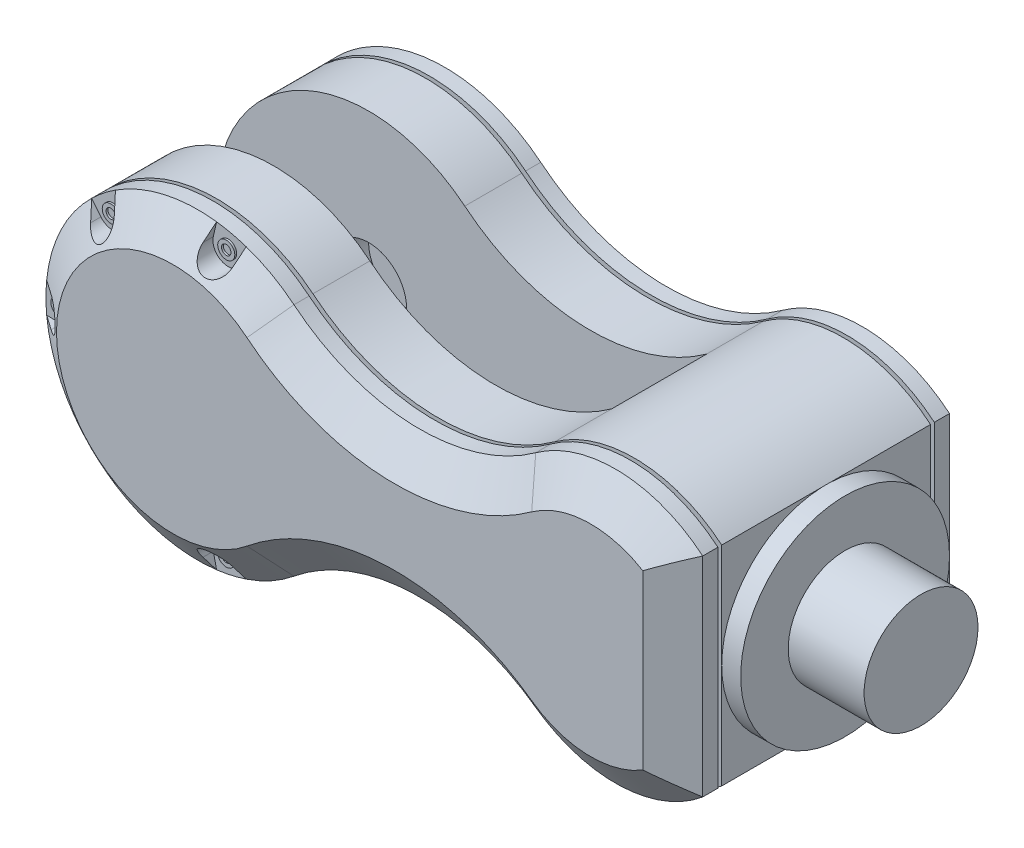
from build123d import *

# Parameters (mm, degrees)
SKETCH1_R            = 27.5
BOSS_EXTRUDE1_DEPTH  = 5
BOSS_EXTRUDE2_DEPTH  = 15
BOSS_EXTRUDE7_DEPTH  = 1
BOSS_EXTRUDE8_START  = 4
BOSS_EXTRUDE8_DEPTH  = 4
BOSS_EXTRUDE9_DEPTH  = 6.5
BOSS_EXTRUDE9_DRAFT  = 55
CUT_EXTRUDE1_DEPTH   = 6.5
SKETCH12_R           = 2.25
SKETCH12_R_2         = 1.25
BOSS_EXTRUDE10_DEPTH = 0.5
CIRPATTERN1_COUNT    = 7
BOSS_EXTRUDE11_DEPTH = 40
SKETCH16_R           = 15
BOSS_EXTRUDE12_DEPTH = 20
SKETCH18_R           = 10
CUT_EXTRUDE2_DEPTH   = 10
SKETCH19_R           = 10
CUT_EXTRUDE3_DEPTH   = 10


# Read off the part's stored shape, not the designer's step: Mirror1
with BuildPart() as part:
    # Sketch1 → Boss-Extrude1 (new body)
    with BuildSketch(Plane(origin=(0, 0, 0), x_dir=(0, 0, -1), z_dir=(1, 0, 0))):
        Circle(SKETCH1_R)
    extrude(amount=BOSS_EXTRUDE1_DEPTH)

    # Sketch4 → Boss-Extrude2 (add)
    with BuildSketch(Plane.XY.offset(-27.5)):
        with BuildLine():
            Line((0, 0), (0, 27.482553635))
            ThreePointArc((0, 27.482553635), (-21.72553999, 35.814333806), (-43.988353288, 29.047887712))
            ThreePointArc((-43.988353288, 29.047887712), (-76.154905904, 19.173432902), (-107.671425291, 30.9590585))
            ThreePointArc((-107.671425291, 30.9590585), (-173, 0), (-107.671425291, -30.9590585))
            ThreePointArc((-107.671425291, -30.9590585), (-76.154905904, -19.173432902), (-43.988353288, -29.047887712))
            ThreePointArc((-43.988353288, -29.047887712), (-21.725129554, -35.812276786), (0, -27.48))
            Line((0, -27.48), (0, 0))
        make_face()
    extrude(amount=BOSS_EXTRUDE2_DEPTH)

    # Sketch6 → Boss-Extrude7 (add)
    with BuildSketch(Plane(origin=(0, 0, -27.5), x_dir=(-1, 0, 0), z_dir=(0, 0, -1))):
        with BuildLine():
            Line((2.5, 0), (2.5, -26.28633009))
            ThreePointArc((2.5, -26.28633009), (22.389483813, -33.329398602), (42.524199496, -27.021498393))
            ThreePointArc((42.524199496, -27.021498393), (76.229898782, -16.674557942), (109.254461211, -29.024117344))
            ThreePointArc((109.254461211, -29.024117344), (170.5, 0), (109.254461211, 29.024117344))
            ThreePointArc((109.254461211, 29.024117344), (76.229898782, 16.674557942), (42.524199496, 27.021498393))
            ThreePointArc((42.524199496, 27.021498393), (22.389897228, 33.331419351), (2.5, 26.288890075))
            Line((2.5, 26.288890075), (2.5, 0))
        make_face()
    extrude(amount=BOSS_EXTRUDE7_DEPTH)

    # Sketch9 → Boss-Extrude8 (add)
    with BuildSketch(Plane(origin=(0, 0, -28.5), x_dir=(-1, 0, 0), z_dir=(0, 0, -1)).offset(BOSS_EXTRUDE8_START)):
        with BuildLine():
            Line((0, 0), (0, 27.482553635))
            ThreePointArc((0, 27.482553635), (21.72553999, 35.814333806), (43.988353288, 29.047887712))
            ThreePointArc((43.988353288, 29.047887712), (76.154905904, 19.173432902), (107.671425291, 30.9590585))
            ThreePointArc((107.671425291, 30.9590585), (173, 0), (107.671425291, -30.9590585))
            ThreePointArc((107.671425291, -30.9590585), (76.154905904, -19.173432902), (43.988353288, -29.047887712))
            ThreePointArc((43.988353288, -29.047887712), (21.725129554, -35.812276786), (0, -27.48))
            Line((0, -27.48), (0, 0))
        make_face()
    extrude(amount=-BOSS_EXTRUDE8_DEPTH)


with BuildPart() as boss_extrude9_tool:
    # Sketch10 → Boss-Extrude9 (with draft: the straight prism first)
    with BuildSketch(Plane(origin=(0, 0, -32.5), x_dir=(-1, 0, 0), z_dir=(0, 0, -1))):
        with BuildLine():
            Line((0, 27.482553635), (0, -27.48))
            ThreePointArc((0, -27.48), (21.725129554, -35.812276786), (43.988353288, -29.047887712))
            ThreePointArc((43.988353288, -29.047887712), (76.154905904, -19.173432902), (107.671425291, -30.9590585))
            ThreePointArc((107.671425291, -30.9590585), (173, 0), (107.671425291, 30.9590585))
            ThreePointArc((107.671425291, 30.9590585), (76.154905904, 19.173432902), (43.988353288, 29.047887712))
            ThreePointArc((43.988353288, 29.047887712), (21.72553999, 35.814333806), (0, 27.482553635))
        make_face()
    extrude(amount=BOSS_EXTRUDE9_DEPTH)
    # Boss-Extrude9: the draft: its side faces are tilted about the plane it starts from
    boss_extrude9_sides = [boss_extrude9_tool.faces().sort_by_distance(p)[0] for p in [
        (-21.72553999, 35.814333806, -35.75),
        (0, 0.001276817, -35.75),
        (-21.725129554, -35.812276786, -35.75),
        (-76.154905904, -19.173432902, -35.75),
        (-173, 0, -35.75),
        (-76.154905904, 19.173432902, -35.75),
    ]]
    draft(boss_extrude9_sides, Plane(origin=(0, 0, -32.5), x_dir=(-1, 0, 0), z_dir=(0, 0, -1)), BOSS_EXTRUDE9_DRAFT)


with BuildPart() as part_1:
    add(part.part)

    # Boss-Extrude9: add boss_extrude9_tool
    add(boss_extrude9_tool.part)

    # Sketch11 → Cut-Extrude1 (cut)
    with BuildSketch(Plane(origin=(0, 0, -39), x_dir=(-1, 0, 0), z_dir=(0, 0, -1))):
        with BuildLine():
            Line((168.906526508, 4), (173.826526508, 4))
            Line((173.826526508, 4), (173.826526508, -4))
            Line((173.826526508, -4), (168.906526508, -4))
            ThreePointArc((168.906526508, -4), (164.906526508, 0), (168.906526508, 4))
        make_face()
    cut_extrude1 = extrude(amount=-CUT_EXTRUDE1_DEPTH, mode=Mode.SUBTRACT)

    # Sketch12 → Boss-Extrude10 (add)
    with BuildSketch(Plane(origin=(0, 0, -32.5), x_dir=(-1, 0, 0), z_dir=(0, 0, -1))):
        with Locations((168.953263254, 0)):
            Circle(SKETCH12_R)
        with Locations((168.953263254, 0)):
            Circle(SKETCH12_R_2, mode=Mode.SUBTRACT)
    boss_extrude10 = extrude(amount=BOSS_EXTRUDE10_DEPTH)

    # CirPattern1: Cut-Extrude1, Boss-Extrude10 ×7 about axis, 2 skipped
    cirpattern1_axis = Axis((-133, 0, 0), (0, 0, 1))
    add([cut_extrude1.rotate(cirpattern1_axis, i * 360 / CIRPATTERN1_COUNT) for i in range(1, CIRPATTERN1_COUNT) if i not in (3, 4)], mode=Mode.SUBTRACT)
    add([boss_extrude10.rotate(cirpattern1_axis, i * 360 / CIRPATTERN1_COUNT) for i in range(1, CIRPATTERN1_COUNT) if i not in (3, 4)])

    # Sketch13 → Boss-Extrude11 (add)
    with BuildSketch(Plane.XY.offset(-12.5)):
        with BuildLine():
            Line((-43.988353288, 29.047887712), (-43.988353288, -29.047887712))
            ThreePointArc((-43.988353288, -29.047887712), (-21.725129554, -35.812276786), (0, -27.48))
            Line((0, -27.48), (0, -24.494897428))
            Line((0, -24.494897428), (0, 24.494897428))
            Line((0, 24.494897428), (0, 27.482553635))
            ThreePointArc((0, 27.482553635), (-21.72553999, 35.814333806), (-43.988353288, 29.047887712))
        make_face()
    extrude(amount=BOSS_EXTRUDE11_DEPTH)

    # Mirror1: part across plane


with BuildPart() as part_2:
    add(part_1.part)
    add(part_1.part.mirror(Plane.XY))

    # Sketch16 → Boss-Extrude12 (add)
    with BuildSketch(Plane(origin=(5, 0, 0), x_dir=(0, 0, -1), z_dir=(1, 0, 0))):
        Circle(SKETCH16_R)
    extrude(amount=BOSS_EXTRUDE12_DEPTH)

    # Sketch18 → Cut-Extrude2 (cut)
    with BuildSketch(Plane.XY.offset(-12.5)):
        with Locations((-133, 0)):
            Circle(SKETCH18_R)
    extrude(amount=-CUT_EXTRUDE2_DEPTH, mode=Mode.SUBTRACT)

    # Sketch19 → Cut-Extrude3 (cut)
    with BuildSketch(Plane(origin=(0, 0, 12.5), x_dir=(-1, 0, 0), z_dir=(0, 0, -1))):
        with Locations((133, -0.967461382)):
            Circle(SKETCH19_R)
    extrude(amount=-CUT_EXTRUDE3_DEPTH, mode=Mode.SUBTRACT)


solid = part_2.part
